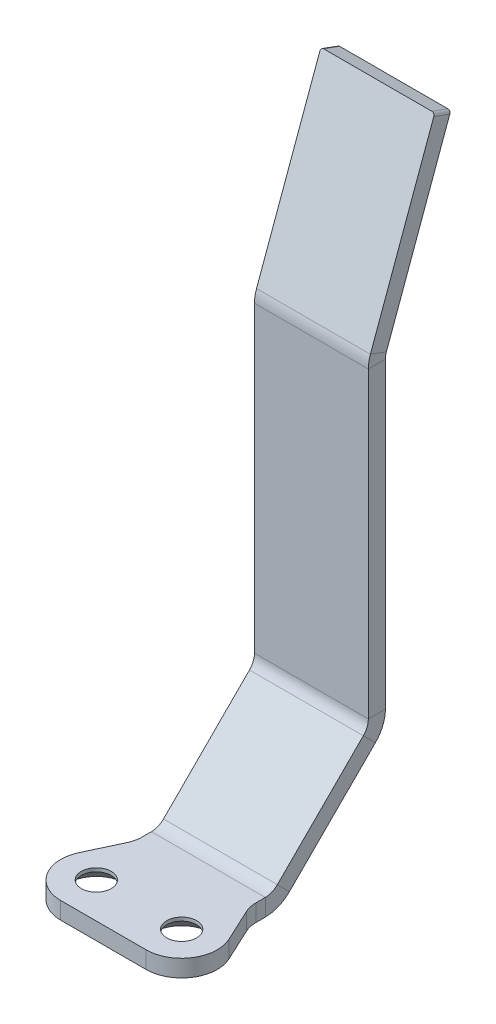
from build123d import *

# Parameters (mm, degrees)
SKETCH1_R                  = 5.25
EXTRUDE1_DEPTH             = 6
PROCESS_BENDS1_START       = -28
PROCESS_BENDS1_DEPTH       = 56
PROCESS_BENDS1_START_2     = -20
PROCESS_BENDS1_2_DEPTH     = 40
PROCESS_BENDS1_START_3     = -27.5
PROCESS_BENDS1_3_DEPTH     = 55
PROCESS_BENDS1_START_4     = 67
PROCESS_BENDS1_4_DEPTH     = 8
PROCESS_BENDS1_START_5     = 49.934347195
PROCESS_BENDS1_5_OUTLINE_R = 5.25
PROCESS_BENDS1_5_DEPTH     = 43.065652805
CHAMFER1_SIZE              = 4.75


with BuildPart() as part:
    # Sketch1 → Extrude1 (new body)
    with BuildSketch(Plane.XY):
        with BuildLine():
            Line((-15, 0), (15, 0))
            ThreePointArc((15, 0), (25.542393073, 5.783754896), (26.328847338, 17.782728272))
            Line((26.328847338, 17.782728272), (20.93692213, 29.345749196))
            ThreePointArc((20.93692213, 29.345749196), (20.237039929, 31.407535674), (20, 33.571931813))
            Line((20, 33.571931813), (20, 266.5))
            ThreePointArc((20, 266.5), (19.707106781, 267.207106781), (19, 267.5))
            Line((19, 267.5), (-19, 267.5))
            ThreePointArc((-19, 267.5), (-19.707106781, 267.207106781), (-20, 266.5))
            Line((-20, 266.5), (-20, 33.571931813))
            ThreePointArc((-20, 33.571931813), (-20.237039929, 31.407535674), (-20.93692213, 29.345749196))
            Line((-20.93692213, 29.345749196), (-26.328847338, 17.782728272))
            ThreePointArc((-26.328847338, 17.782728272), (-25.542393073, 5.783754896), (-15, 0))
        make_face()
        with Locations((15, 12.5)):
            Circle(SKETCH1_R, mode=Mode.SUBTRACT)
        with Locations(Location((-15, 12.5, 0), (0, 0, 180))):
            Circle(SKETCH1_R, mode=Mode.SUBTRACT)
    extrude(amount=EXTRUDE1_DEPTH)

    # Process-Bends1: read off the stored shape, not the designer's step
    # Process-Bends1 outline → Process-Bends1 (cut)
    with BuildSketch(Plane.YZ.offset(PROCESS_BENDS1_START)):
        with BuildLine():
            Line((202.708327384, 5.276311449), (217.204873948, 0))
            Line((217.204873948, 0), (267.5, 0))
            Line((267.5, 0), (267.5, 6))
            Line((267.5, 6), (198.604085664, 6))
            ThreePointArc((198.604085664, 6), (200.687863796, 5.817693036), (202.708327384, 5.276311449))
        make_face()
        with BuildLine():
            Line((0, 0), (92.140807255, 0))
            ThreePointArc((92.140807255, 0), (87.548606067, 0.91344561), (83.655525881, 3.514718626))
            Line((83.655525881, 3.514718626), (81.170244507, 6))
            Line((81.170244507, 6), (0, 6))
            Line((0, 6), (0, 0))
        make_face()
    extrude(amount=PROCESS_BENDS1_DEPTH, mode=Mode.SUBTRACT)

    # Process-Bends1 2 outline → Process-Bends1 2 (add)
    with BuildSketch(Plane.YZ.offset(PROCESS_BENDS1_START_2)):
        with BuildLine():
            Line((262.773728027, -22.970773129), (264.825848887, -17.332617404))
            Line((264.825848887, -17.332617404), (217.204873948, 0))
            Line((217.204873948, 0), (198.604085664, 0))
            ThreePointArc((198.604085664, 0), (199.64597473, -0.091153482), (200.656206524, -0.361844275))
            Line((200.656206524, -0.361844275), (262.773728027, -22.970773129))
        make_face()
        with BuildLine():
            Line((81.170244507, 6), (92.140807255, 6))
            ThreePointArc((92.140807255, 6), (89.844706661, 6.456722805), (87.898166568, 7.757359313))
            Line((87.898166568, 7.757359313), (57.691706508, 37.963819374))
            ThreePointArc((57.691706508, 37.963819374), (56.39107, 39.910359467), (55.934347195, 42.206460061))
            Line((55.934347195, 42.206460061), (55.934347195, 79.065652805))
            Line((55.934347195, 79.065652805), (49.934347195, 79.065652805))
            Line((49.934347195, 79.065652805), (49.934347195, 42.206460061))
            ThreePointArc((49.934347195, 42.206460061), (50.847792805, 37.614258872), (53.44906582, 33.721178686))
            Line((53.44906582, 33.721178686), (81.170244507, 6))
        make_face()
    extrude(amount=PROCESS_BENDS1_2_DEPTH)

    # Process-Bends1 3 outline → Process-Bends1 3 (add)
    with BuildSketch(Plane.YZ.offset(PROCESS_BENDS1_START_3)):
        with BuildLine():
            Line((81.170244507, 6), (92.140807255, 6))
            ThreePointArc((92.140807255, 6), (89.844706661, 6.456722805), (87.898166568, 7.757359313))
            Line((87.898166568, 7.757359313), (57.691706508, 37.963819374))
            ThreePointArc((57.691706508, 37.963819374), (56.39107, 39.910359467), (55.934347195, 42.206460061))
            Line((55.934347195, 42.206460061), (55.934347195, 79.065652805))
            Line((55.934347195, 79.065652805), (49.934347195, 79.065652805))
            Line((49.934347195, 79.065652805), (49.934347195, 42.206460061))
            ThreePointArc((49.934347195, 42.206460061), (50.847792805, 37.614258872), (53.44906582, 33.721178686))
            Line((53.44906582, 33.721178686), (81.170244507, 6))
        make_face()
    extrude(amount=PROCESS_BENDS1_3_DEPTH)

    # Process-Bends1 4 outline → Process-Bends1 4 (cut)
    with BuildSketch(Plane(origin=(0, 0, 0), x_dir=(1, 0, 0), z_dir=(0, 0.3420201433256691, 0.9396926207859083)).offset(PROCESS_BENDS1_START_4)):
        with BuildLine():
            Line((20, 254.783000281), (19, 254.783000281))
            ThreePointArc((19, 254.783000281), (19.707106781, 254.490107062), (20, 253.783000281))
            Line((20, 253.783000281), (20, 254.783000281))
        make_face()
        with BuildLine():
            ThreePointArc((-20, 253.783000281), (-19.707106781, 254.490107062), (-19, 254.783000281))
            Line((-19, 254.783000281), (-20, 254.783000281))
            Line((-20, 254.783000281), (-20, 253.783000281))
        make_face()
    extrude(amount=PROCESS_BENDS1_4_DEPTH, mode=Mode.SUBTRACT)

    # Process-Bends1 5 outline → Process-Bends1 5 (cut)
    with BuildSketch(Plane(origin=(0, 0, 0), x_dir=(1, 0, 0), z_dir=(0, 1, 0)).offset(PROCESS_BENDS1_START_5)):
        with BuildLine():
            ThreePointArc((-20.93692213, -49.719903609), (-20.237039929, -47.658117131), (-20, -45.493720992))
            Line((-20, -45.493720992), (-20, -6))
            Line((-20, -6), (-27.5, -6))
            Line((-27.5, -6), (-27.5, -66.565652806))
            ThreePointArc((-27.5, -66.565652806), (-27.203700089, -63.860157632), (-26.328847338, -61.282924534))
            Line((-26.328847338, -61.282924534), (-20.93692213, -49.719903609))
        make_face()
        with BuildLine():
            ThreePointArc((26.328847338, -61.282924534), (27.203700089, -63.860157632), (27.5, -66.565652806))
            Line((27.5, -66.565652806), (27.5, -6))
            Line((27.5, -6), (20, -6))
            Line((20, -6), (20, -45.493720992))
            ThreePointArc((20, -45.493720992), (20.237039929, -47.658117131), (20.93692213, -49.719903609))
            Line((20.93692213, -49.719903609), (26.328847338, -61.282924534))
        make_face()
        with BuildLine():
            ThreePointArc((27.5, -66.565652806), (23.838834765, -75.404487571), (15, -79.065652805))
            Line((15, -79.065652805), (27.5, -79.065652805))
            Line((27.5, -79.065652805), (27.5, -66.565652806))
        make_face()
        with BuildLine():
            ThreePointArc((-15, -79.065652805), (-23.838834765, -75.404487571), (-27.5, -66.565652806))
            Line((-27.5, -66.565652806), (-27.5, -79.065652805))
            Line((-27.5, -79.065652805), (-15, -79.065652805))
        make_face()
        with Locations((-15, -66.565652805)):
            Circle(PROCESS_BENDS1_5_OUTLINE_R)
        with Locations((15, -66.565652805)):
            Circle(PROCESS_BENDS1_5_OUTLINE_R)
    extrude(amount=PROCESS_BENDS1_5_DEPTH, mode=Mode.SUBTRACT)

    # Chamfer1
    chamfer1_edges = [part.edges().sort_by_distance(p)[0] for p in [
        (9.75, 49.934347195, 66.565652805),
        (-20.25, 49.934347195, 66.565652805),
    ]]
    chamfer(chamfer1_edges, length=CHAMFER1_SIZE)


solid = part.part
